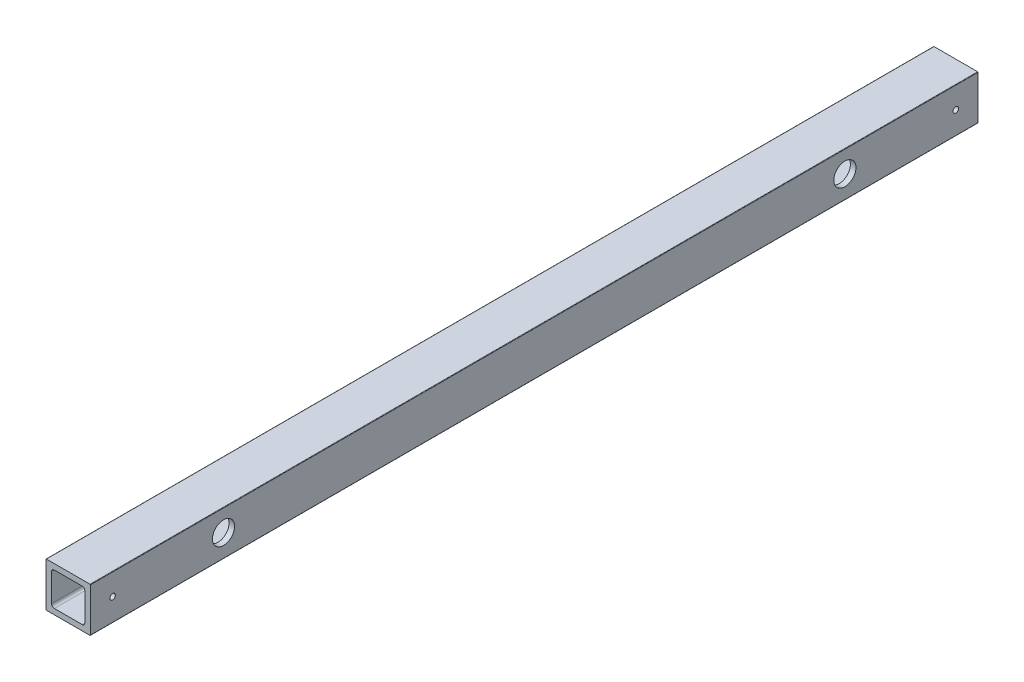
from build123d import *

# Parameters (mm, degrees)
BOSS_EXTRUDE1_DEPTH = 508
SKETCH2_R           = 1.5875
SKETCH2_R_2         = 6.35
CUT_EXTRUDE1_DEPTH  = 510.268416456


with BuildPart() as part:
    # Sketch1 → Boss-Extrude1 (new body)
    with BuildSketch(Plane(origin=(0, 0, 0), x_dir=(-1, 0, 0), z_dir=(0, 0, -1))):
        with BuildLine():
            Line((0, 0.254), (0, 25.146))
            ThreePointArc((0, 25.146), (-0.074394878, 25.325605122), (-0.254, 25.4))
            Line((-0.254, 25.4), (-25.146, 25.4))
            ThreePointArc((-25.146, 25.4), (-25.325605122, 25.325605122), (-25.4, 25.146))
            Line((-25.4, 25.146), (-25.4, 0.254))
            ThreePointArc((-25.4, 0.254), (-25.325605122, 0.074394878), (-25.146, 0))
            Line((-25.146, 0), (-0.254, 0))
            ThreePointArc((-0.254, 0), (-0.074394878, 0.074394878), (0, 0.254))
        make_face()
        with BuildLine():
            Line((-3.175, 20.6375), (-3.175, 4.7625))
            ThreePointArc((-3.175, 4.7625), (-3.639967985, 3.639967985), (-4.7625, 3.175))
            Line((-4.7625, 3.175), (-20.6375, 3.175))
            ThreePointArc((-20.6375, 3.175), (-21.760032015, 3.639967985), (-22.225, 4.7625))
            Line((-22.225, 4.7625), (-22.225, 20.6375))
            ThreePointArc((-22.225, 20.6375), (-21.760032015, 21.760032015), (-20.6375, 22.225))
            Line((-20.6375, 22.225), (-4.7625, 22.225))
            ThreePointArc((-4.7625, 22.225), (-3.639967985, 21.760032015), (-3.175, 20.6375))
        make_face(mode=Mode.SUBTRACT)
    extrude(amount=-BOSS_EXTRUDE1_DEPTH)

    # Sketch2 → Cut-Extrude1 (cut, through all)
    with BuildSketch(Plane.ZY):
        with Locations((12.697459746, 12.954)):
            Circle(SKETCH2_R)
        with Locations((495.3, 12.954)):
            Circle(SKETCH2_R)
        with Locations((76.2, 12.954)):
            Circle(SKETCH2_R_2)
        with Locations((431.8, 12.954)):
            Circle(SKETCH2_R_2)
    extrude(amount=-CUT_EXTRUDE1_DEPTH, mode=Mode.SUBTRACT)


solid = part.part
